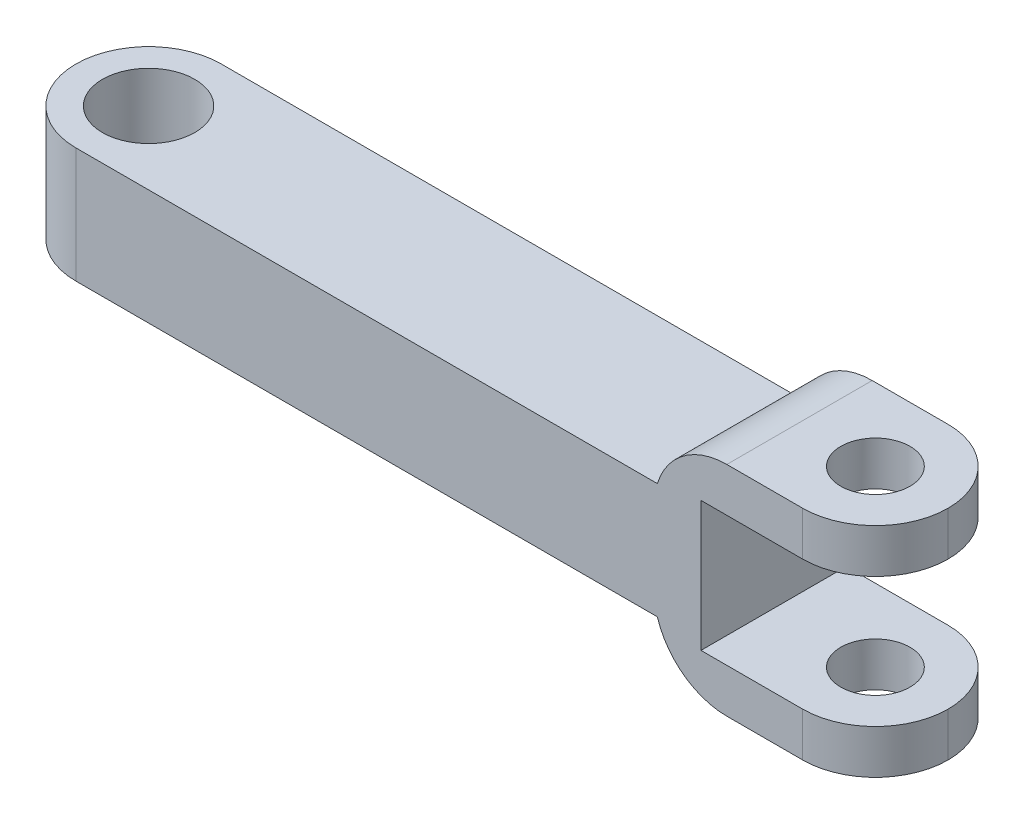
from build123d import *

# Parameters (mm, degrees)
SKETCH1_W           = 60
SKETCH1_H           = 15
BOSS_EXTRUDE1_DEPTH = 10
SKETCH2_W           = 12
SKETCH2_H           = 8.9375
CUT_EXTRUDE1_DEPTH  = 63.649820431
SKETCH4_W           = 45
SKETCH4_H           = 3.53125
CUT_EXTRUDE3_DEPTH  = 63.649820431
FILLET1_R           = 5
FILLET2_R           = 5
SKETCH3_R           = 3.175
SKETCH3_R_2         = 2.38125
CUT_EXTRUDE2_DEPTH  = 63.649820431


# Some blends are built 0.0001 mm under size
with BuildPart() as part:
    # Sketch1 → Boss-Extrude1 (new body)
    with BuildSketch(Plane.XY):
        with Locations((30, 7.5)):
            Rectangle(SKETCH1_W, SKETCH1_H)
    extrude(amount=BOSS_EXTRUDE1_DEPTH)

    # Sketch2 → Cut-Extrude1 (cut, through all)
    with BuildSketch(Plane.XY.offset(10)):
        with Locations((54, 7.5)):
            Rectangle(SKETCH2_W, SKETCH2_H)
    extrude(amount=-CUT_EXTRUDE1_DEPTH, mode=Mode.SUBTRACT)

    # Sketch4 → Cut-Extrude3 (cut, through all)
    with BuildSketch(Plane.XY.offset(10)):
        with Locations((22.5, 13.234375)):
            Rectangle(SKETCH4_W, SKETCH4_H)
        with Locations((22.5, 1.765625)):
            Rectangle(SKETCH4_W, SKETCH4_H)
    extrude(amount=-CUT_EXTRUDE3_DEPTH, mode=Mode.SUBTRACT)

    # Fillet1
    fillet1_edges = [part.edges().sort_by_distance(p)[0] for p in [
        (60, 1.515625, 0),
        (60, 1.515625, 10),
        (60, 13.484375, 0),
        (60, 13.484375, 10),
        (0, 7.5, 0),
        (0, 7.5, 10),
    ]]
    fillet(fillet1_edges, radius=FILLET1_R - 0.0001)  # a hair under: the kernel refuses the full size

    # Fillet2
    # the kernel refuses this fillet: 5 mm, written as the material it takes off along each edge
    with BuildSketch(Plane(origin=(45, 0, 21.948528528), x_dir=(1, 0, 0), z_dir=(0, 0, -1))) as fillet2_piece_1:
        with BuildLine():
            CenterArc((4.779411411, -5), FILLET2_R, 90, 72.917402966)
            Line((0, -3.53125), (-0.095588228, -3.501875))
            ThreePointArc((-0.095588228, -3.501875), (-0.1, -1.765625), (-0.1, 0))
            Line((-0.1, 0), (0, 0.1))
            Line((0, 0.1), (4.779411411, 0.1))
            Line((4.779411411, 0.1), (4.779411411, 0))
        make_face()
    extrude(amount=33.897057056, mode=Mode.SUBTRACT)
    with BuildSketch(Plane(origin=(45, 15, 21.948528528), x_dir=(0, -1, 0), z_dir=(0, 0, -1))) as fillet2_piece_2:
        with BuildLine():
            CenterArc((5, -4.779411411), FILLET2_R, 107.082597034, 72.917402966)
            Line((0, -4.779411411), (-0.1, -4.779411411))
            Line((-0.1, -4.779411411), (-0.1, 0))
            Line((-0.1, 0), (0, 0.1))
            ThreePointArc((0, 0.1), (1.765625, 0.1), (3.501875, 0.095588228))
            Line((3.501875, 0.095588228), (3.53125, 0))
        make_face()
    extrude(amount=33.897057056, mode=Mode.SUBTRACT)

    # Sketch3 → Cut-Extrude2 (cut, through all)
    with BuildSketch(Plane(origin=(0, 15, 0), x_dir=(1, 0, 0), z_dir=(0, 1, 0))):
        with Locations(Location((5, -5, 0), (0, 0, 270))):
            Circle(SKETCH3_R)
        with Locations(Location((55, -5, 0), (0, 0, 270))):
            Circle(SKETCH3_R_2)
    extrude(amount=-CUT_EXTRUDE2_DEPTH, mode=Mode.SUBTRACT)


solid = part.part
